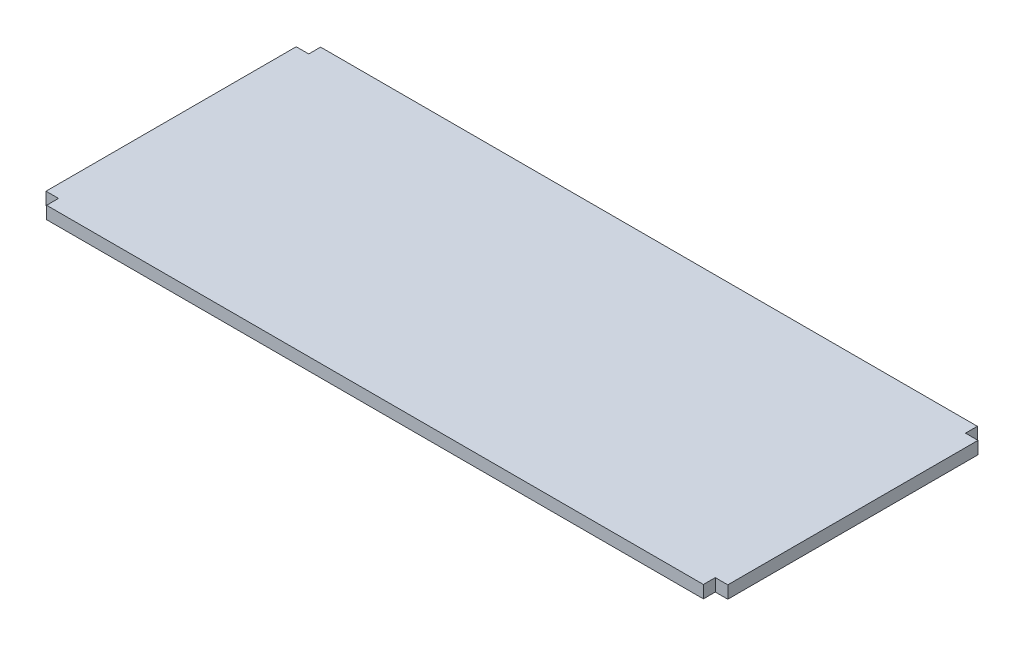
from build123d import *

# Parameters (mm, degrees)
BOSS_EXTRUDE1_DEPTH = 2.54


with BuildPart() as part:
    # Sketch1 → Boss-Extrude1 (new body)
    with BuildSketch(Plane(origin=(0, 0, 0), x_dir=(1, 0, 0), z_dir=(0, 1, 0))):
        Polygon((-66.675, 27.813), (-66.675, 25.4), (-69.215, 25.4), (-69.215, -25.4), (-66.675, -25.4), (-66.675, -27.813), (66.675, -27.813), (66.675, -25.4), (69.215, -25.4), (69.215, 25.4), (66.675, 25.4), (66.675, 27.813), align=None)
    extrude(amount=BOSS_EXTRUDE1_DEPTH)


solid = part.part
